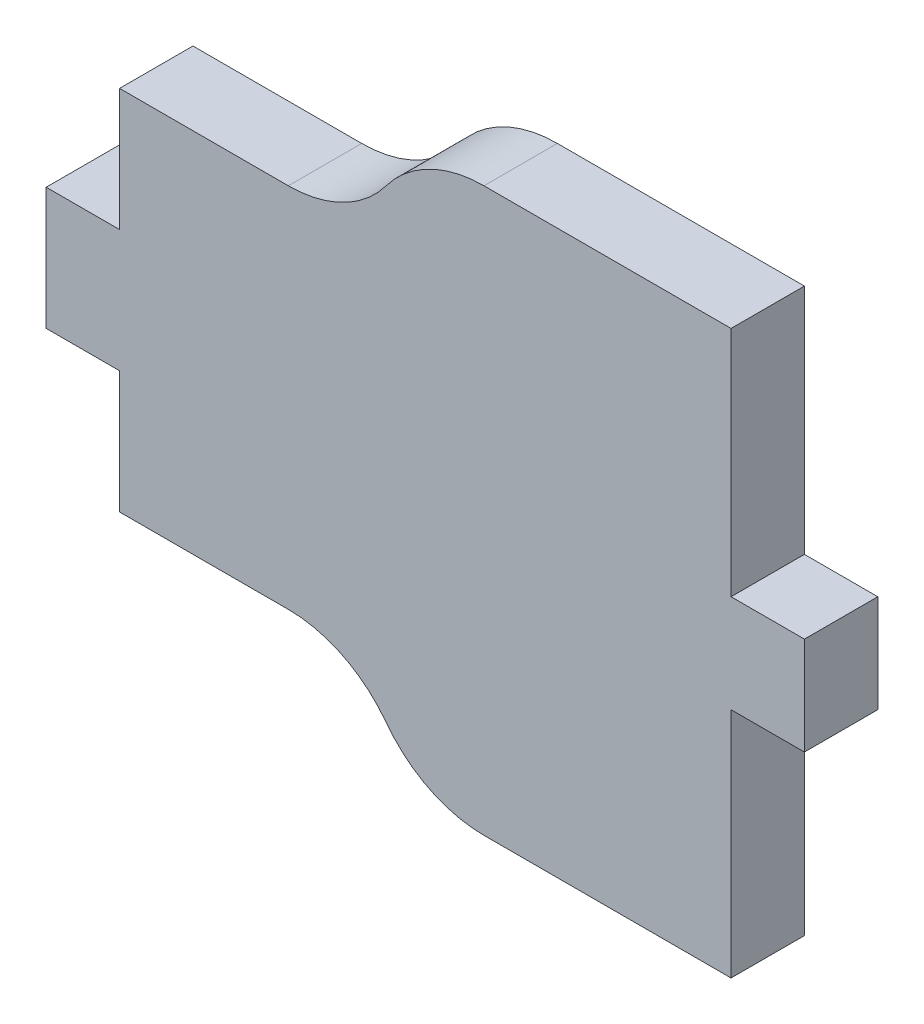
from build123d import *

# Parameters (mm, degrees)
ESQUISSE1_W        = 50
ESQUISSE1_H        = 30
BOSS_EXTRU_1_DEPTH = 6
ESQUISSE3_W        = 30
ESQUISSE3_H        = 8
BOSS_EXTRU_2_DEPTH = 6
CONG_1_R           = 10
CONG_2_R           = 10
CONG_3_R           = 10
CONG_4_R           = 10
ESQUISSE7_W        = 6
ESQUISSE7_H        = 10
ESQUISSE7_H_2      = 8
BOSS_EXTRU_3_DEPTH = 6


with BuildPart() as part:
    # Esquisse1 → Boss.-Extru.1 (new body)
    with BuildSketch(Plane.XY):
        with Locations((2.73294214, 3.066688104)):
            Rectangle(ESQUISSE1_W, ESQUISSE1_H)
    extrude(amount=BOSS_EXTRU_1_DEPTH)

    # Esquisse3 → Boss.-Extru.2 (add)
    with BuildSketch(Plane.XY.offset(6)):
        with Locations((12.73294214, 22.066688104)):
            Rectangle(ESQUISSE3_W, ESQUISSE3_H)
        with Locations((12.73294214, -15.933311896)):
            Rectangle(ESQUISSE3_W, ESQUISSE3_H)
    extrude(amount=-BOSS_EXTRU_2_DEPTH)

    # Congé1
    # the kernel refuses this fillet: 10 mm, written as the material it takes off along each edge
    with BuildSketch(Plane(origin=(-2.26705786, 26.066688104, 30.494897428), x_dir=(1, 0, 0), z_dir=(0, 0, -1))) as cong_1_piece_1:
        with BuildLine():
            CenterArc((9.797958971, 10), CONG_1_R, 191.536959033, 78.463040967)
            Line((0, 8), (-0.195959179, 7.96))
            ThreePointArc((-0.195959179, 7.96), (-0.2, 4), (-0.2, 0))
            Line((-0.2, 0), (0, -0.2))
            Line((0, -0.2), (9.797958971, -0.2))
            Line((9.797958971, -0.2), (9.797958971, 0))
        make_face()
    extrude(amount=54.989794856, mode=Mode.SUBTRACT)

    # Congé2
    # the kernel refuses this fillet: 10 mm, written as the material it takes off along each edge
    with BuildSketch(Plane(origin=(-2.26705786, -19.933311896, 30.494897428), x_dir=(0, 1, 0), z_dir=(0, 0, -1))) as cong_2_piece_1:
        with BuildLine():
            CenterArc((10, 9.797958971), CONG_2_R, 180, 78.463040967)
            Line((0, 9.797958971), (-0.2, 9.797958971))
            Line((-0.2, 9.797958971), (-0.2, 0))
            Line((-0.2, 0), (0, -0.2))
            ThreePointArc((0, -0.2), (4, -0.2), (7.96, -0.195959179))
            Line((7.96, -0.195959179), (8, 0))
        make_face()
    extrude(amount=54.989794856, mode=Mode.SUBTRACT)

    # Congé3
    cong_3_edges = [part.edges().sort_by_distance(p)[0] for p in [
        (-2.26705786, 18.066688104, 3),
    ]]
    fillet(cong_3_edges, radius=CONG_3_R)

    # Congé4
    cong_4_edges = [part.edges().sort_by_distance(p)[0] for p in [
        (-2.26705786, -11.933311896, 3),
    ]]
    fillet(cong_4_edges, radius=CONG_4_R)

    # Esquisse7 → Boss.-Extru.3 (add)
    with BuildSketch(Plane.XY.offset(6)):
        with Locations((-25.26705786, 3.066688104)):
            Rectangle(ESQUISSE7_W, ESQUISSE7_H)
        with Locations((30.73294214, 3.066688104)):
            Rectangle(ESQUISSE7_W, ESQUISSE7_H_2)
    extrude(amount=-BOSS_EXTRU_3_DEPTH)


solid = part.part
